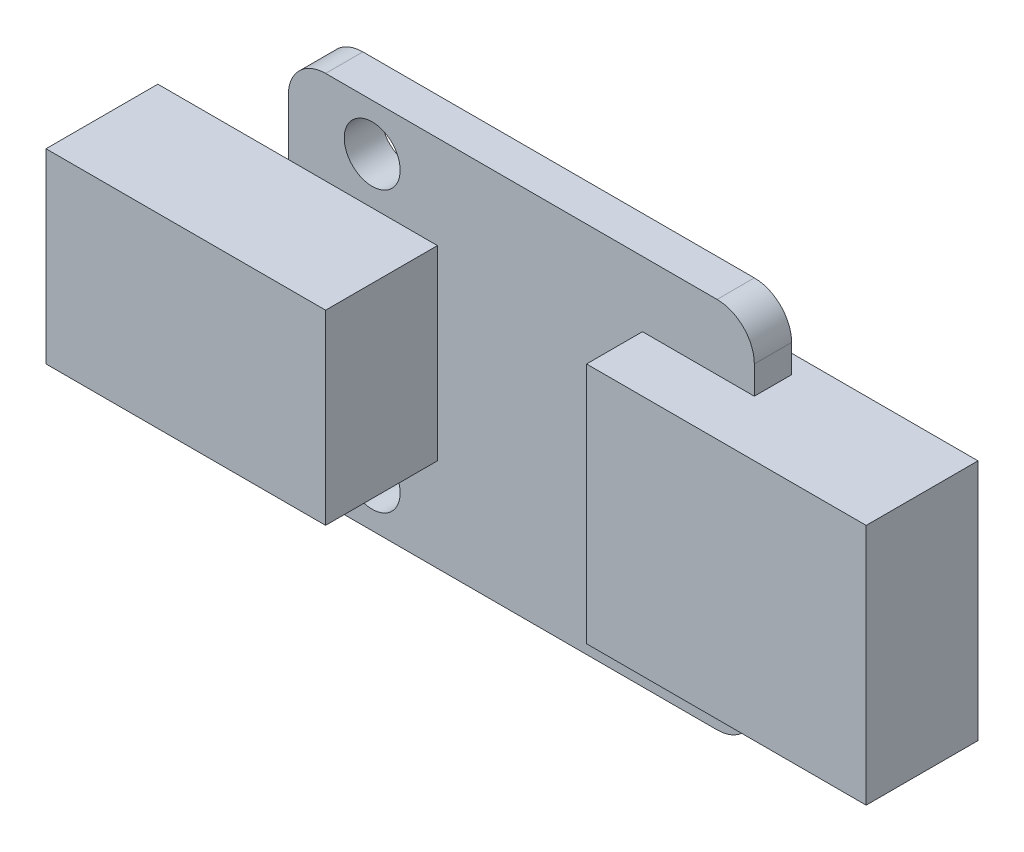
from build123d import *

# Parameters (mm, degrees)
SKETCH3_W           = 25
SKETCH3_H           = 20
SKETCH3_R           = 1.5
BOSS_EXTRUDE1_DEPTH = 2
SKETCH4_W           = 15
SKETCH4_H           = 13
BOSS_EXTRUDE2_DEPTH = 3
SKETCH5_W           = 15
SKETCH5_H           = 10
BOSS_EXTRUDE3_DEPTH = 6
FILLET1_R           = 2


with BuildPart() as part:
    # Sketch3 → Boss-Extrude1 (new body)
    with BuildSketch(Plane.XY):
        Rectangle(SKETCH3_W, SKETCH3_H)
        with Locations((-8, 7.5)):
            Circle(SKETCH3_R, mode=Mode.SUBTRACT)
        with Locations((-8, -7.5)):
            Circle(SKETCH3_R, mode=Mode.SUBTRACT)
    extrude(amount=BOSS_EXTRUDE1_DEPTH)

    # Sketch4 → Boss-Extrude2 (add, symmetric)
    with BuildSketch(Plane.XY.offset(2)):
        with Locations((14, 0)):
            Rectangle(SKETCH4_W, SKETCH4_H)
    extrude(amount=BOSS_EXTRUDE2_DEPTH, both=True)

    # Sketch5 → Boss-Extrude3 (add)
    with BuildSketch(Plane.XY.offset(2)):
        with Locations((-12, 0)):
            Rectangle(SKETCH5_W, SKETCH5_H)
    extrude(amount=BOSS_EXTRUDE3_DEPTH)

    # Fillet1
    fillet1_edges = [part.edges().sort_by_distance(p)[0] for p in [
        (-12.5, 10, 1),
        (12.5, 10, 1),
        (-12.5, -10, 1),
        (12.5, -10, 1),
    ]]
    fillet(fillet1_edges, radius=FILLET1_R)


solid = part.part
